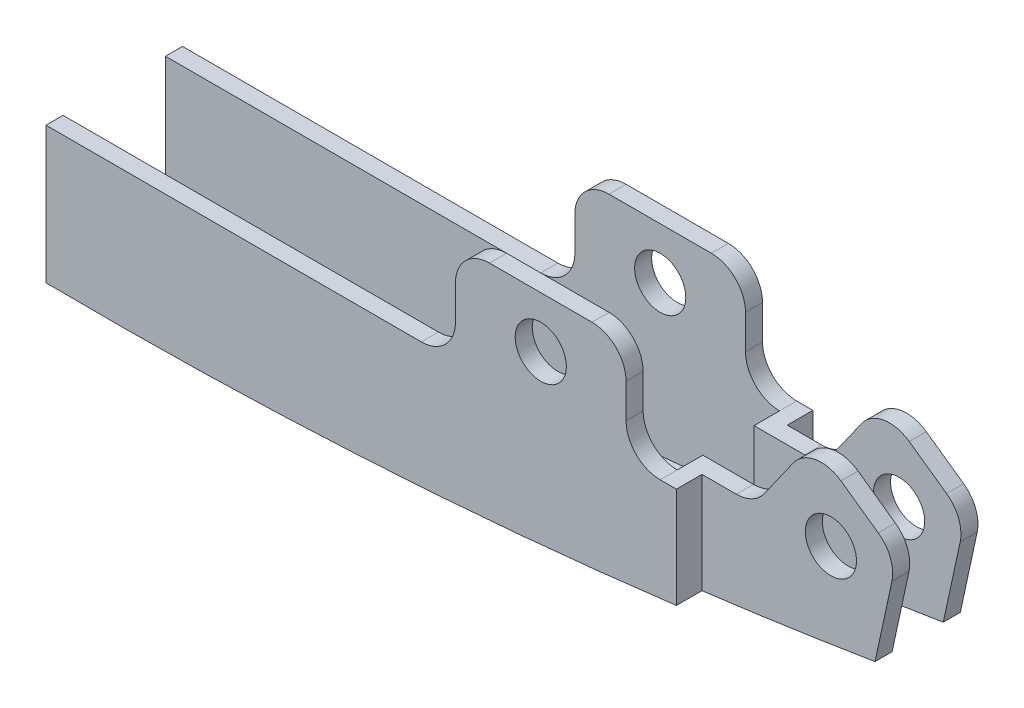
from build123d import *

# Parameters (mm, degrees)
SCHIZZO2_R                     = 0.75
ESTRUSIONE_ESTRUSIONE1_DEPTH   = 4
TAGLIO_ESTRUSIONE1_START       = 0.5
TAGLIO_ESTRUSIONE1_OUTLINE_R   = 0.75
TAGLIO_ESTRUSIONE1_DEPTH       = 3
TAGLIO_ESTRUSIONE1_START_2     = 1.25
TAGLIO_ESTRUSIONE1_2_OUTLINE_R = 0.75
TAGLIO_ESTRUSIONE1_2_DEPTH     = 1.5
SCHIZZO5_W                     = 7
SCHIZZO5_H                     = 3
TAGLIO_ESTRUSIONE4_DEPTH       = 10
SCHIZZO6_W                     = 4
SCHIZZO6_H                     = 1.5
TAGLIO_ESTRUSIONE5_DEPTH       = 17.747826397


# Read off the part's stored shape, not the designer's step: Taglio-Estrusione1
with BuildPart() as part:
    # Schizzo2 → Estrusione-Estrusione1 (new body)
    with BuildSketch(Plane.XY):
        with BuildLine():
            Line((-1.674960789, 7.009651551), (1.325039211, 7.009651551))
            ThreePointArc((1.325039211, 7.009651551), (2.032145992, 6.716758332), (2.325039211, 6.009651551))
            Line((2.325039211, 6.009651551), (2.325039211, 5.009651551))
            ThreePointArc((2.325039211, 5.009651551), (2.61793243, 4.30254477), (3.325039211, 4.009651551))
            Line((3.325039211, 4.009651551), (4.807645267, 4.009651551))
            ThreePointArc((4.807645267, 4.009651551), (5.267175084, 4.121489209), (5.623919425, 4.431986858))
            Line((5.623919425, 4.431986858), (6.480368598, 5.642199868))
            ThreePointArc((6.480368598, 5.642199868), (7.127920386, 6.050198789), (7.87430745, 5.880809333))
            Line((7.87430745, 5.880809333), (8.967214405, 5.107375855))
            ThreePointArc((8.967214405, 5.107375855), (9.321590916, 4.653454003), (9.366876691, 4.079366068))
            Line((9.366876691, 4.079366068), (8.871648882, 1.793499009))
            ThreePointArc((8.871648882, 1.793499009), (-2.862577448, 0.385742883), (-14.674960789, 0.009651551))
            Line((-14.674960789, 0.009651551), (-14.674960789, 4.009651551))
            Line((-14.674960789, 4.009651551), (-3.674960789, 4.009651551))
            ThreePointArc((-3.674960789, 4.009651551), (-2.967854008, 4.30254477), (-2.674960789, 5.009651551))
            Line((-2.674960789, 5.009651551), (-2.674960789, 6.009651551))
            ThreePointArc((-2.674960789, 6.009651551), (-2.38206757, 6.716758332), (-1.674960789, 7.009651551))
        make_face()
        with Locations((-0.174960789, 5.509651551)):
            Circle(SCHIZZO2_R, mode=Mode.SUBTRACT)
        with Locations((7.577394386, 4.07554752)):
            Circle(SCHIZZO2_R, mode=Mode.SUBTRACT)
    extrude(amount=ESTRUSIONE_ESTRUSIONE1_DEPTH)

    # Taglio-Estrusione1 outline → Taglio-Estrusione1 (cut)
    with BuildSketch(Plane.XY.offset(TAGLIO_ESTRUSIONE1_START)):
        with BuildLine():
            ThreePointArc((-14.674960789, 0.509651551), (-5.658443288, 0.703091506), (3.325039211, 1.498106631))
            Line((3.325039211, 1.498106631), (3.325039211, 4.009651551))
            ThreePointArc((3.325039211, 4.009651551), (2.61793243, 4.30254477), (2.325039211, 5.009651551))
            Line((2.325039211, 5.009651551), (2.325039211, 6.009651551))
            ThreePointArc((2.325039211, 6.009651551), (2.032145992, 6.716758332), (1.325039211, 7.009651551))
            Line((1.325039211, 7.009651551), (-1.674960789, 7.009651551))
            ThreePointArc((-1.674960789, 7.009651551), (-2.38206757, 6.716758332), (-2.674960789, 6.009651551))
            Line((-2.674960789, 6.009651551), (-2.674960789, 5.009651551))
            ThreePointArc((-2.674960789, 5.009651551), (-2.967854008, 4.30254477), (-3.674960789, 4.009651551))
            Line((-3.674960789, 4.009651551), (-14.674960789, 4.009651551))
            Line((-14.674960789, 4.009651551), (-14.674960789, 0.509651551))
        make_face()
        with Locations((-0.174960789, 5.509651551)):
            Circle(TAGLIO_ESTRUSIONE1_OUTLINE_R, mode=Mode.SUBTRACT)
    extrude(amount=TAGLIO_ESTRUSIONE1_DEPTH, mode=Mode.SUBTRACT)

    # Taglio-Estrusione1 2 outline → Taglio-Estrusione1 2 (cut)
    with BuildSketch(Plane.XY.offset(TAGLIO_ESTRUSIONE1_START_2)):
        with BuildLine():
            ThreePointArc((3.325039211, 1.498106631), (6.158824123, 1.87511554), (8.983990596, 2.312044653))
            Line((8.983990596, 2.312044653), (9.366876691, 4.079366068))
            ThreePointArc((9.366876691, 4.079366068), (9.321590916, 4.653454003), (8.967214405, 5.107375855))
            Line((8.967214405, 5.107375855), (7.87430745, 5.880809333))
            ThreePointArc((7.87430745, 5.880809333), (7.127920386, 6.050198789), (6.480368598, 5.642199868))
            Line((6.480368598, 5.642199868), (5.623919425, 4.431986858))
            ThreePointArc((5.623919425, 4.431986858), (5.267175084, 4.121489209), (4.807645267, 4.009651551))
            Line((4.807645267, 4.009651551), (3.325039211, 4.009651551))
            Line((3.325039211, 4.009651551), (3.325039211, 1.498106631))
        make_face()
        with Locations((7.577394386, 4.07554752)):
            Circle(TAGLIO_ESTRUSIONE1_2_OUTLINE_R, mode=Mode.SUBTRACT)
    extrude(amount=TAGLIO_ESTRUSIONE1_2_DEPTH, mode=Mode.SUBTRACT)

    # Schizzo5 → Taglio-Estrusione4 (cut)
    with BuildSketch(Plane(origin=(0, 0, 0), x_dir=(1, 0, 0), z_dir=(0, 1, 0))):
        with Locations((7.3, 0.75)):
            Rectangle(SCHIZZO5_W, SCHIZZO5_H)
        with Locations((7.3, -4.75)):
            Rectangle(SCHIZZO5_W, SCHIZZO5_H)
    extrude(amount=TAGLIO_ESTRUSIONE4_DEPTH, mode=Mode.SUBTRACT)

    # Schizzo6 → Taglio-Estrusione5 (cut, through all)
    with BuildSketch(Plane(origin=(0, 7.009651551, 0), x_dir=(1, 0, 0), z_dir=(0, 1, 0))):
        with Locations((6.983990596, -2)):
            Rectangle(SCHIZZO6_W, SCHIZZO6_H)
    extrude(amount=-TAGLIO_ESTRUSIONE5_DEPTH, mode=Mode.SUBTRACT)


solid = part.part
